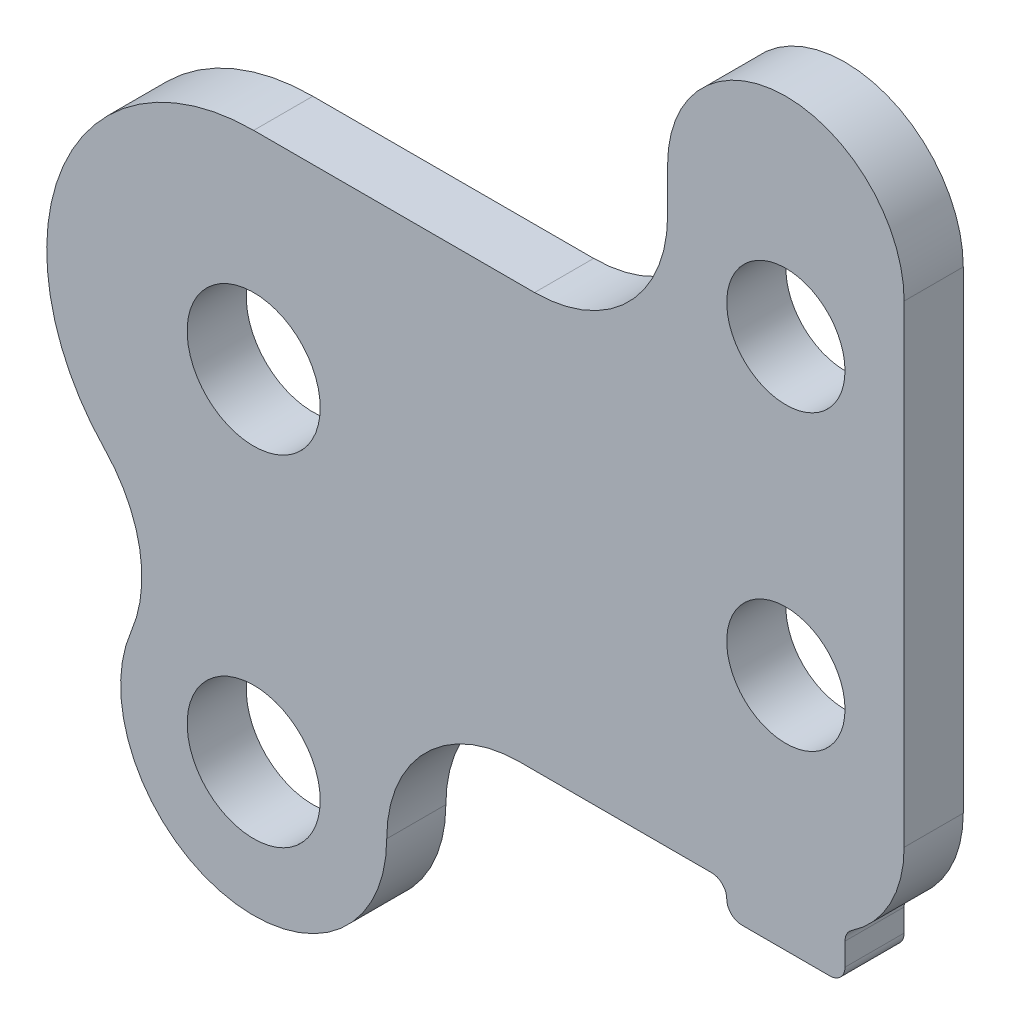
from build123d import *

# Parameters (mm, degrees)
SKETCH1_R           = 1.5875
SKETCH1_R_2         = 1.7859375
BOSS_EXTRUDE1_DEPTH = 1.5875
FILLET1_R           = 0.4064
FILLET2_R           = 3.571875


with BuildPart() as part:
    # Sketch1 → Boss-Extrude1 (new body)
    with BuildSketch(Plane.XY):
        with BuildLine():
            ThreePointArc((17.462464722, 10.31875), (14.287464722, 13.49375), (11.112464722, 10.31875))
            Line((11.112464722, 10.31875), (11.112464722, 5.55625))
            Line((11.112464722, 5.55625), (0, 5.55625))
            ThreePointArc((0, 5.55625), (-5.113201992, 2.17418478), (-4.001636336, -3.854714088))
            ThreePointArc((-4.001636336, -3.854714088), (-3.061446663, -5.6851033), (-3.287058398, -7.730434724))
            ThreePointArc((-3.287058398, -7.730434724), (-0.713207299, -12.628071623), (3.571875, -9.128125))
            ThreePointArc((3.571875, -9.128125), (4.61805296, -6.602427972), (7.143749984, -5.55625))
            Line((7.143749984, -5.55625), (12.699964722, -5.55625))
            Line((12.699964722, -5.55625), (12.699964722, -6.36905))
            Line((12.699964722, -6.36905), (15.874964722, -6.36905))
            Line((15.874964722, -6.36905), (15.874964722, -5.130880657))
            ThreePointArc((15.874964722, -5.130880657), (17.037095379, -3.96875), (17.462464722, -2.38125))
            Line((17.462464722, -2.38125), (17.462464722, 10.31875))
        make_face()
        with Locations((14.287464722, 0.03175)):
            Circle(SKETCH1_R, mode=Mode.SUBTRACT)
        with Locations((14.287464722, 7.90575)):
            Circle(SKETCH1_R, mode=Mode.SUBTRACT)
        Circle(SKETCH1_R_2, mode=Mode.SUBTRACT)
        with Locations((0, -9.128125)):
            Circle(SKETCH1_R_2, mode=Mode.SUBTRACT)
    extrude(amount=BOSS_EXTRUDE1_DEPTH)

    # Fillet1
    fillet1_edges = [part.edges().sort_by_distance(p)[0] for p in [
        (15.874964722, -5.130880657, 0.79375),
        (15.874964722, -6.36905, 0.79375),
        (12.699964722, -5.55625, 0.79375),
        (12.699964722, -6.36905, 0.79375),
    ]]
    fillet(fillet1_edges, radius=FILLET1_R - 0.0001)  # a hair under: the kernel refuses the full size

    # Fillet2
    fillet2_edges = [part.edges().sort_by_distance(p)[0] for p in [
        (11.112464722, 5.55625, 0.79375),
    ]]
    fillet(fillet2_edges, radius=FILLET2_R)


solid = part.part
